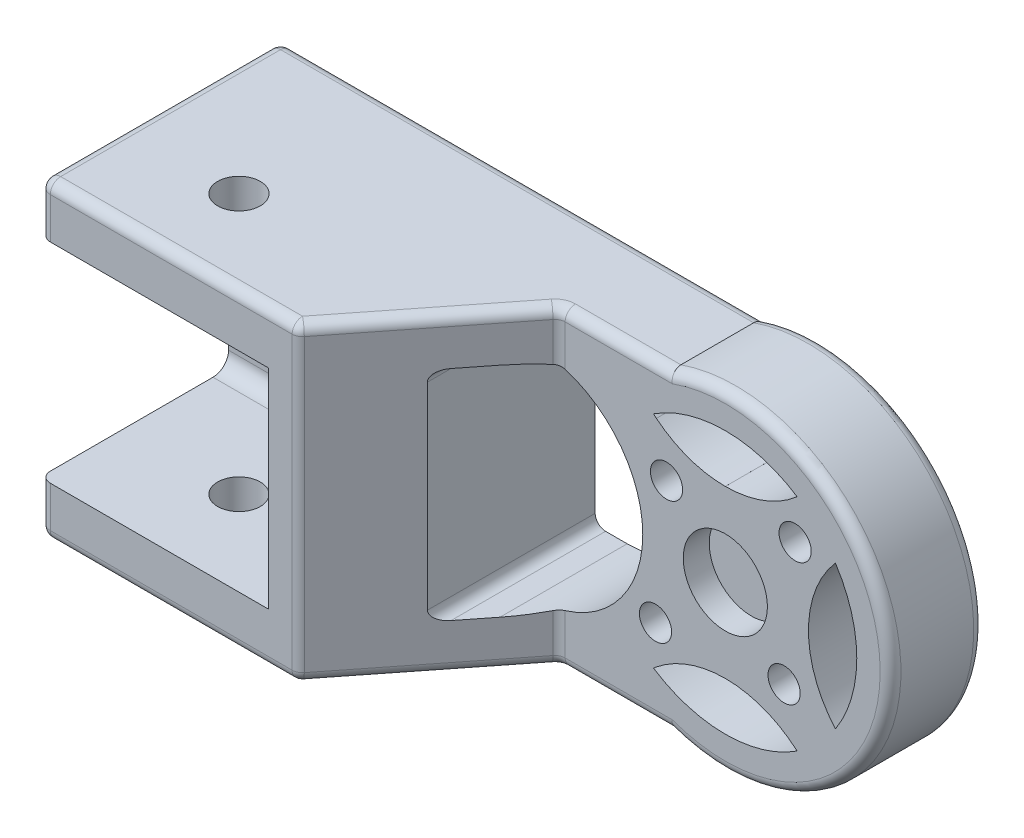
from build123d import *

# Parameters (mm, degrees)
ESQUISSE4_R                   = 13.9
ESQUISSE4_R_2                 = 1.55
BOSS_EXTRU_3_DEPTH            = 4.5
ESQUISSE7_R                   = 15.9
ESQUISSE7_R_2                 = 13.9
BOSS_EXTRU_7_DEPTH            = 9
BOSS_EXTRU_8_DEPTH            = 30
ENL_V_START                   = -4.5
ENL_V_MAT_EXTRU_12_OUTLINE_R  = 1.55
ENL_V_MAT_EXTRU_12_DEPTH      = 9
TROU_TARAUD_M32_D             = 2.5
TROU_TARAUD_M32_DEPTH         = 26.66
TROU_TARAUD_M32_CSINK_D       = 3.5
TROU_TARAUD_M32_CSINK_ANGLE   = 90
ENL_V_MAT_EXTRU_1_DEPTH       = 22
ESQUISSE13_R                  = 2.05
ENL_V_MAT_EXTRU_4_DEPTH       = 65.256925163
ESQUISSE15_R                  = 2.05
ENL_V_MAT_EXTRU_5_DEPTH       = 61.387436039
ENL_V_MAT_EXTRU_6_DEPTH       = 73.985973625
ESQUISSE24_R                  = 4.05
ENL_V_MAT_EXTRU_9_DEPTH       = 2.5
TROU_TARAUD_M33_D             = 2.5
TROU_TARAUD_M33_DEPTH         = 23.155777755
TROU_TARAUD_M33_CSINK_D       = 3.5
TROU_TARAUD_M33_CSINK_ANGLE   = 90
CONG_2_R                      = 1
ENL_V_MAT_EXTRU_13_DEPTH      = 57.002436454
ENL_V_MAT_EXTRU_13_DEPTH_BACK = 57.002436454
CONG_3_R                      = 1
CONG_4_R                      = 1


# Read off the part's stored shape, not the designer's step: Enlèv. mat.-Extru.12
with BuildPart() as part:
    # Esquisse4 → Boss.-Extru.3 (new, symmetric)
    with BuildSketch(Plane.XY):
        Circle(ESQUISSE4_R)
        with Locations((-6.717514421, -6.717514421)):
            Circle(ESQUISSE4_R_2, mode=Mode.SUBTRACT)
        with Locations((6.717514421, 6.717514421)):
            Circle(ESQUISSE4_R_2, mode=Mode.SUBTRACT)
        with Locations((-5.656854249, 5.656854249)):
            Circle(ESQUISSE4_R_2, mode=Mode.SUBTRACT)
        with Locations((5.656854249, -5.656854249)):
            Circle(ESQUISSE4_R_2, mode=Mode.SUBTRACT)
        with BuildLine():
            ThreePointArc((-10.594734512, 6.911881121), (-12.65, 0), (-10.594734512, -6.911881121))
            ThreePointArc((-10.594734512, -6.911881121), (-7.999175124, 0), (-10.594734512, 6.911881121))
        make_face(mode=Mode.SUBTRACT)
        with BuildLine():
            ThreePointArc((6.911881121, -10.594734512), (0, -7.999175124), (-6.911881121, -10.594734512))
            ThreePointArc((-6.911881121, -10.594734512), (0, -12.65), (6.911881121, -10.594734512))
        make_face(mode=Mode.SUBTRACT)
        with BuildLine():
            ThreePointArc((-6.911881121, 10.594734512), (0, 7.999175124), (6.911881121, 10.594734512))
            ThreePointArc((6.911881121, 10.594734512), (0, 12.65), (-6.911881121, 10.594734512))
        make_face(mode=Mode.SUBTRACT)
        with BuildLine():
            ThreePointArc((10.594734512, 6.911881121), (7.999175124, 0), (10.594734512, -6.911881121))
            ThreePointArc((10.594734512, -6.911881121), (12.65, 0), (10.594734512, 6.911881121))
        make_face(mode=Mode.SUBTRACT)
    extrude(amount=BOSS_EXTRU_3_DEPTH, both=True)

    # Esquisse7 → Boss.-Extru.7 (add)
    with BuildSketch(Plane.XY.offset(4.5)):
        Circle(ESQUISSE7_R)
        Circle(ESQUISSE7_R_2, mode=Mode.SUBTRACT)
    extrude(amount=-BOSS_EXTRU_7_DEPTH)

    # Esquisse6 → Boss.-Extru.8 (add)
    with BuildSketch(Plane(origin=(0, -15, 0), x_dir=(1, 0, 0), z_dir=(0, 1, 0))):
        Polygon((-51.798424989, -22.16), (-29.798424989, -22.16), (-15.9, -4.5), (0, -4.5), (0, 4.5), (-15.9, 4.5), (-51.798424989, 4.5), align=None)
    extrude(amount=BOSS_EXTRU_8_DEPTH)

    # Enlèv. mat.-Extru.12 outline → Enlèv. mat.-Extru.12 (cut)
    with BuildSketch(Plane.XY.offset(ENL_V_START)):
        with BuildLine():
            ThreePointArc((0, 12.65), (-3.605489456, 12.125301884), (-6.911881121, 10.594734512))
            ThreePointArc((-6.911881121, 10.594734512), (-6.773099648, 10.475509721), (-6.632262004, 10.358720998))
            ThreePointArc((-6.632262004, 10.358720998), (-6.631896353, 10.3589551), (-6.631530694, 10.359189189))
            ThreePointArc((-6.631530694, 10.359189189), (-3.519338467, 8.607363508), (0, 8))
            Line((0, 8), (0, 12.65))
        make_face()
        with BuildLine():
            ThreePointArc((-6.911881121, -10.594734512), (-3.605489456, -12.125301884), (0, -12.65))
            Line((0, -12.65), (0, -8))
            ThreePointArc((0, -8), (-3.519338467, -8.607363508), (-6.631530694, -10.359189189))
            ThreePointArc((-6.631530694, -10.359189189), (-6.631896353, -10.3589551), (-6.632262004, -10.358720998))
            ThreePointArc((-6.632262004, -10.358720998), (-6.773099648, -10.475509721), (-6.911881121, -10.594734512))
        make_face()
        with BuildLine():
            ThreePointArc((-10.358720998, 6.632262004), (-10.475509721, 6.773099648), (-10.594734512, 6.911881121))
            ThreePointArc((-10.594734512, 6.911881121), (-12.65, 0), (-10.594734512, -6.911881121))
            ThreePointArc((-10.594734512, -6.911881121), (-10.475509721, -6.773099648), (-10.358720998, -6.632262004))
            ThreePointArc((-10.358720998, -6.632262004), (-10.3589551, -6.631896353), (-10.359189189, -6.631530694))
            ThreePointArc((-10.359189189, -6.631530694), (-8, 0), (-10.359189189, 6.631530694))
            ThreePointArc((-10.359189189, 6.631530694), (-10.3589551, 6.631896353), (-10.358720998, 6.632262004))
        make_face()
        with Locations((-6.717514421, -6.717514421)):
            Circle(ENL_V_MAT_EXTRU_12_OUTLINE_R)
        with Locations((-5.656854249, 5.656854249)):
            Circle(ENL_V_MAT_EXTRU_12_OUTLINE_R)
    extrude(amount=ENL_V_MAT_EXTRU_12_DEPTH, mode=Mode.SUBTRACT)

    # Trou taraudé M32
    with Locations(Plane(origin=(5.656854249, -5.656854249, -4.5), x_dir=(-1, 0, 0), z_dir=(0, 0, -1))):
        with Locations((0, 0), (-1.060660172, 12.37436867)):
            CounterSinkHole(TROU_TARAUD_M32_D / 2, TROU_TARAUD_M32_CSINK_D / 2, depth=TROU_TARAUD_M32_DEPTH, counter_sink_angle=TROU_TARAUD_M32_CSINK_ANGLE)

    # Esquisse8 → Enlèv. mat.-Extru.1 (cut)
    with BuildSketch(Plane.ZY.offset(51.798424989)):
        with BuildLine():
            Line((19, 10.05), (2, 10.05))
            ThreePointArc((2, 10.05), (0.939339828, 9.610660172), (0.5, 8.55))
            Line((0.5, 8.55), (0.5, -8.55))
            ThreePointArc((0.5, -8.55), (0.939339828, -9.610660172), (2, -10.05))
            Line((2, -10.05), (19, -10.05))
            ThreePointArc((19, -10.05), (20.060660172, -9.610660172), (20.5, -8.55))
            Line((20.5, -8.55), (20.5, 8.55))
            ThreePointArc((20.5, 8.55), (20.060660172, 9.610660172), (19, 10.05))
        make_face()
    extrude(amount=-ENL_V_MAT_EXTRU_1_DEPTH, mode=Mode.SUBTRACT)

    # Esquisse13 → Enlèv. mat.-Extru.4 (cut, through all)
    with BuildSketch(Plane.XZ.offset(15)):
        with Locations(Location((-40.798424989, 10.5, 0), (0, 0, 270))):
            Circle(ESQUISSE13_R)
    extrude(amount=-ENL_V_MAT_EXTRU_4_DEPTH, mode=Mode.SUBTRACT)

    # Esquisse15 → Enlèv. mat.-Extru.5 (cut, through all)
    with BuildSketch(Plane(origin=(0, 0, -4.5), x_dir=(-1, 0, 0), z_dir=(0, 0, -1))):
        with Locations((40.798424989, 0)):
            Circle(ESQUISSE15_R)
    extrude(amount=-ENL_V_MAT_EXTRU_5_DEPTH, mode=Mode.SUBTRACT)

    # Esquisse16 → Enlèv. mat.-Extru.6 (cut, through all)
    with BuildSketch(Plane.ZY.offset(51.798424989)):
        Polygon((18.655777755, 10.05), (18.655777755, -10.05), (18.655777755, -15), (22.16, -15), (22.16, 15), (18.655777755, 15), align=None)
    extrude(amount=-ENL_V_MAT_EXTRU_6_DEPTH, mode=Mode.SUBTRACT)

    # Esquisse24 → Enlèv. mat.-Extru.9 (cut)
    with BuildSketch(Plane.XY.offset(4.5)):
        Circle(ESQUISSE24_R)
    extrude(amount=-ENL_V_MAT_EXTRU_9_DEPTH, mode=Mode.SUBTRACT)

    # Trou taraudé M33
    with Locations(Plane(origin=(0, 0, -4.5), x_dir=(-1, 0, 0), z_dir=(0, 0, -1))):
        with Locations((6.717514421, -6.717514421), (5.656854249, 5.656854249)):
            CounterSinkHole(TROU_TARAUD_M33_D / 2, TROU_TARAUD_M33_CSINK_D / 2, depth=TROU_TARAUD_M33_DEPTH, counter_sink_angle=TROU_TARAUD_M33_CSINK_ANGLE)

    # Congé2
    cong_2_edges = [part.edges().sort_by_distance(p)[0] for p in [
        (-21.470300546, -15, 11.577888877),
        (-21.470300546, 15, 11.577888877),
        (-39.419513041, 15, 18.655777755),
        (-27.040601092, 0, 18.655777755),
        (-39.419513041, -15, 18.655777755),
        (15.9, 0, -4.5),
        (15.9, 0, 4.5),
        (-15.9, 0, 4.5),
        (-10.586759375, -15, 4.5),
        (-28.535971869, -15, -4.5),
        (-51.798424989, 0, -4.5),
        (-28.535971869, 15, -4.5),
        (-10.586759375, 15, 4.5),
    ]]
    fillet(cong_2_edges, radius=CONG_2_R)

    # Esquisse27 → Enlèv. mat.-Extru.13 (cut, two sides: drawn at the far end of the back side and taken through both)
    with BuildSketch(Plane.XY.offset(4.5).offset(-ENL_V_MAT_EXTRU_13_DEPTH_BACK)):
        with BuildLine():
            Line((-18.443262039, -10.5), (-21.520938865, -10.5))
            Line((-21.520938865, -10.5), (-21.520938865, 10.5))
            Line((-21.520938865, 10.5), (-18.443262039, 10.5))
            ThreePointArc((-18.443262039, 10.5), (-7.943262039, 0), (-18.443262039, -10.5))
        make_face()
    extrude(amount=ENL_V_MAT_EXTRU_13_DEPTH + ENL_V_MAT_EXTRU_13_DEPTH_BACK, mode=Mode.SUBTRACT)

    # Congé3
    cong_3_edges = [part.edges().sort_by_distance(p)[0] for p in [
        (-21.520938865, 10.5, 3.571116167),
        (-21.520938865, -10.5, 3.571116167),
    ]]
    fillet(cong_3_edges, radius=CONG_3_R)

    # Congé4
    # the kernel refuses this fillet: 1 mm, written as the material it takes off along each edge
    with BuildSketch(Plane(origin=(-50.798424989, 14, -3.5), x_dir=(-1, 0, 0), z_dir=(0, 1, 0))) as cong_4_piece_1_section:
        Polygon((0, 0), (CONG_4_R, 0), (CONG_4_R, -CONG_4_R), (0, -CONG_4_R), align=None)
    cong_4_piece_1 = extrude(amount=CONG_4_R, mode=Mode.PRIVATE)
    cong_4_piece_1 = cong_4_piece_1 - Plane(origin=(-50.798424989, 14, -3.5), x_dir=(0.7071067811865477, 0, 0.7071067811865475), z_dir=(0, 1, 0)) * Sphere(CONG_4_R, mode=Mode.PRIVATE)
    add(cong_4_piece_1, mode=Mode.SUBTRACT)
    with BuildSketch(Plane(origin=(-50.798424989, -14, -3.5), x_dir=(-1, 0, 0), z_dir=(0, -1, 0))) as cong_4_piece_2_section:
        Polygon((0, 0), (CONG_4_R, 0), (CONG_4_R, CONG_4_R), (0, CONG_4_R), align=None)
    cong_4_piece_2 = extrude(amount=CONG_4_R, mode=Mode.PRIVATE)
    cong_4_piece_2 = cong_4_piece_2 - Plane(origin=(-50.798424989, -14, -3.5), x_dir=(0.7071067811865477, 0, 0.7071067811865475), z_dir=(0, -1, 0)) * Sphere(CONG_4_R, mode=Mode.PRIVATE)
    add(cong_4_piece_2, mode=Mode.SUBTRACT)
    with BuildSketch(Plane(origin=(-51.798424989, -14, 18.655777755), x_dir=(1, 0, 0), z_dir=(0, 1, 0)), Plane(origin=(-51.798424989, 7.55, 18.655777755), x_dir=(1, 0, 0), z_dir=(0, 1, 0))) as cong_4_piece_3:
        with BuildLine():
            CenterArc((CONG_4_R, CONG_4_R), CONG_4_R, 180, 90)
            Line((0, CONG_4_R), (0, 0))
            Line((0, 0), (CONG_4_R, 0))
        make_face()
    extrude(amount=6.45, mode=Mode.SUBTRACT)
    with BuildSketch(Plane(origin=(-51.798424989, -15, -3.5), x_dir=(1, 0, 0), z_dir=(0, 0, 1))) as cong_4_piece_4:
        with BuildLine():
            CenterArc((CONG_4_R, CONG_4_R), CONG_4_R, 180, 90)
            Line((0, CONG_4_R), (0, 0))
            Line((0, 0), (CONG_4_R, 0))
        make_face()
    extrude(amount=21.155777755, mode=Mode.SUBTRACT)
    with BuildSketch(Plane(origin=(-51.798424989, 15, -3.5), x_dir=(1, 0, 0), z_dir=(0, 0, 1))) as cong_4_piece_5:
        with BuildLine():
            CenterArc((CONG_4_R, -CONG_4_R), CONG_4_R, 90, 90)
            Line((0, -CONG_4_R), (0, 0))
            Line((0, 0), (CONG_4_R, 0))
        make_face()
    extrude(amount=21.155777755, mode=Mode.SUBTRACT)
    with BuildSketch(Plane(origin=(-51.798424989, 14, 17.655777755), x_dir=(0, 0, 1), z_dir=(0, -1, 0))) as cong_4_piece_6:
        with BuildLine():
            CenterArc((1 - CONG_4_R, -CONG_4_R), CONG_4_R, 0, 90)
            Line((1, -CONG_4_R), (1, 0))
            Line((1, 0), (1 - CONG_4_R, 0))
        make_face()
    revolve(axis=Axis((-51.798424989, 14, 17.655777755), (-1, 0, 0)), revolution_arc=90, mode=Mode.SUBTRACT)
    with BuildSketch(Plane(origin=(-51.798424989, -14, 17.655777755), x_dir=(0, 0, 1), z_dir=(0, 1, 0))) as cong_4_piece_7:
        with BuildLine():
            CenterArc((1 - CONG_4_R, CONG_4_R), CONG_4_R, 270, 90)
            Line((1 - CONG_4_R, 0), (1, 0))
            Line((1, 0), (1, CONG_4_R))
        make_face()
    revolve(axis=Axis((-51.798424989, -14, 17.655777755), (1, 0, 0)), revolution_arc=90, mode=Mode.SUBTRACT)


solid = part.part
